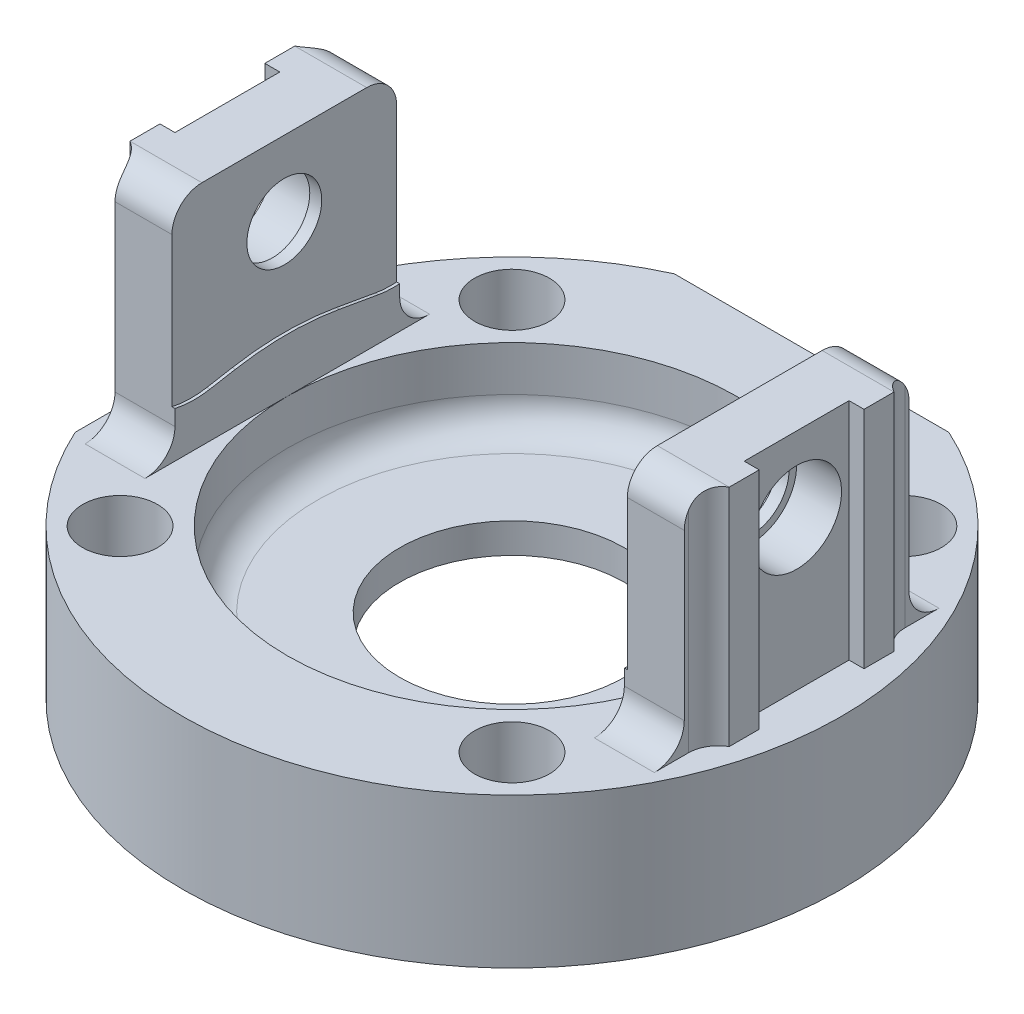
from build123d import *

# Parameters (mm, degrees)
SKETCH1_R                = 22
BOSS_EXTRUDE1_DEPTH      = 10
SKETCH5_R                = 15
CUT_EXTRUDE3_DEPTH       = 5
CUT_EXTRUDE5_START       = -3
SKETCH7_R                = 15
CUT_EXTRUDE5_DEPTH       = 3
SKETCH8_R                = 7.5
CUT_EXTRUDE6_DEPTH       = 3
SKETCH6_R                = 2.5
CUT_EXTRUDE7_DEPTH       = 10
SKETCH9_W                = 6.833639819
SKETCH9_H                = 40.698121589
SKETCH9_W_2              = 26.089318242
SKETCH9_H_2              = 6.104718238
CUT_EXTRUDE8_DEPTH       = 10
BOSS_EXTRUDE3_DEPTH      = 15
FILLET1_R                = 2
FILLET2_R                = 10
CUT_EXTRUDE9_DEPTH       = 42
CUT_EXTRUDE9_DEPTH_BACK  = 15
SKETCH11_R               = 3
FILLET3_START            = 9
FILLET3_DEPTH            = 16
FILLET3_START_2          = -21
FILLET3_2_DEPTH          = 42
FILLET4_R                = 2
CUT_EXTRUDE18_DEPTH      = 30.2
CUT_EXTRUDE18_DEPTH_BACK = 0.2
FILLET5_R                = 20
SKETCH14_R               = 3
SKETCH14_R_2             = 2.5
BOSS_EXTRUDE4_DEPTH      = 0.8
BOSS_EXTRUDE5_START      = -0.8
SKETCH15_R               = 3
SKETCH15_R_2             = 2.5
BOSS_EXTRUDE5_DEPTH      = 0.8
SKETCH17_R               = 2.5
CUT_EXTRUDE20_DEPTH      = 4
SKETCH18_R               = 2.5
CUT_EXTRUDE21_DEPTH      = 4


with BuildPart() as part:
    # Sketch1 → Boss-Extrude1 (new body)
    with BuildSketch(Plane(origin=(0, 0, 0), x_dir=(1, 0, 0), z_dir=(0, 1, 0))):
        with Locations(Location((0, 0, 0), (0, 0, 270))):
            Circle(SKETCH1_R)
    extrude(amount=BOSS_EXTRUDE1_DEPTH)

    # Sketch5 → Cut-Extrude3 (cut)
    with BuildSketch(Plane(origin=(0, 10, 0), x_dir=(1, 0, 0), z_dir=(0, 1, 0))):
        with Locations(Location((0, 0, 0), (0, 0, 270))):
            Circle(SKETCH5_R)
    extrude(amount=-CUT_EXTRUDE3_DEPTH, mode=Mode.SUBTRACT)

    # Sketch7 → Cut-Extrude5 (cut)
    with BuildSketch(Plane(origin=(0, 0, 0), x_dir=(-1, 0, 0), z_dir=(0, -1, 0)).offset(CUT_EXTRUDE5_START)):
        with Locations(Location((0, 0, 0), (0, 0, 270))):
            Circle(SKETCH7_R)
    extrude(amount=CUT_EXTRUDE5_DEPTH, mode=Mode.SUBTRACT)

    # Sketch8 → Cut-Extrude6 (cut)
    with BuildSketch(Plane(origin=(0, 3, 0), x_dir=(-1, 0, 0), z_dir=(0, -1, 0))):
        with Locations(Location((0, 0, 0), (0, 0, 90))):
            Circle(SKETCH8_R)
    extrude(amount=-CUT_EXTRUDE6_DEPTH, mode=Mode.SUBTRACT)

    # Sketch6 → Cut-Extrude7 (cut)
    with BuildSketch(Plane(origin=(0, 10, 0), x_dir=(1, 0, 0), z_dir=(0, 1, 0))):
        with Locations(Location((13.081475452, 13.081475452, 0), (0, 0, 270))):
            Circle(SKETCH6_R)
        with Locations(Location((-13.081475452, -13.081475452, 0), (0, 0, 270))):
            Circle(SKETCH6_R)
        with Locations(Location((-13.081475452, 13.081475452, 0), (0, 0, 270))):
            Circle(SKETCH6_R)
        with Locations(Location((13.081475452, -13.081475452, 0), (0, 0, 270))):
            Circle(SKETCH6_R)
    extrude(amount=-CUT_EXTRUDE7_DEPTH, mode=Mode.SUBTRACT)

    # Sketch9 → Cut-Extrude8 (cut)
    with BuildSketch(Plane(origin=(0, 10, 0), x_dir=(1, 0, 0), z_dir=(0, 1, 0))):
        with Locations((-23.416819909, -5.65916064)):
            Rectangle(SKETCH9_W, SKETCH9_H)
        with Locations((-0.506301064, 23.052359119)):
            Rectangle(SKETCH9_W_2, SKETCH9_H_2)
    extrude(amount=-CUT_EXTRUDE8_DEPTH, mode=Mode.SUBTRACT)

    # Sketch10 → Boss-Extrude3 (add)
    with BuildSketch(Plane(origin=(0, 10, 0), x_dir=(1, 0, 0), z_dir=(0, 1, 0))):
        Polygon((-15, -7.5), (-15, 7.5), (-19, 7.5), (-19, 5.5), (-20, 5.5), (-20, 3.5), (-19, 3.5), (-19, -3.5), (-20, -3.5), (-20, -5.5), (-19, -5.5), (-19, -7.5), align=None)
        Polygon((20, -5.5), (20, -3.5), (19, -3.5), (19, 3.5), (20, 3.5), (20, 5.5), (19, 5.5), (19, 7.5), (15, 7.5), (15, -7.5), (19, -7.5), (19, -5.5), align=None)
    extrude(amount=BOSS_EXTRUDE3_DEPTH)

    # Fillet1
    fillet1_edges = [part.edges().sort_by_distance(p)[0] for p in [
        (-17, 10, -7.5),
        (-17, 25, -7.5),
        (-17, 10, 7.5),
        (-17, 25, 7.5),
        (17, 10, -7.5),
        (17, 10, 7.5),
        (17, 25, -7.5),
        (17, 25, 7.5),
    ]]
    fillet(fillet1_edges, radius=FILLET1_R)

    # Fillet2
    # the kernel refuses this fillet: 10 mm, written as the material it adds along each edge
    with BuildSketch(Plane(origin=(-19, 10, -14.397247359), x_dir=(0, 1, 0), z_dir=(0, 0, 1))) as fillet2_piece_1_section:
        with BuildLine():
            CenterArc((4.358898944, 10), FILLET2_R, 244.158067237, 25.841932763)
            Line((0, 1), (0, 0))
            Line((0, 0), (4.358898944, 0))
        make_face()
    fillet2_piece_1 = extrude(amount=28.794494718, mode=Mode.PRIVATE)
    fillet2_piece_1 = split(fillet2_piece_1, bisect_by=Plane(origin=(-19, 10, -5.5), z_dir=(0, 0, 1)), keep=Keep.TOP, mode=Mode.PRIVATE)
    fillet2_piece_1 = split(fillet2_piece_1, bisect_by=Plane(origin=(-19, 10, 5.5), z_dir=(0, 0, -1)), keep=Keep.TOP, mode=Mode.PRIVATE)
    add(fillet2_piece_1)

    # Sketch11 → Cut-Extrude9 (cut, two sides: drawn at the far end of the back side and taken through both)
    with BuildSketch(Plane(origin=(-15, 0, 0), x_dir=(0, 0, -1), z_dir=(1, 0, 0)).offset(-CUT_EXTRUDE9_DEPTH_BACK)):
        with Locations(Location((0, 20, 0), (0, 0, 180))):
            Circle(SKETCH11_R)
    extrude(amount=CUT_EXTRUDE9_DEPTH + CUT_EXTRUDE9_DEPTH_BACK, mode=Mode.SUBTRACT)

    # Fillet3: read off the stored shape, not the designer's step
    # Fillet3 outline → Fillet3 (add)
    with BuildSketch(Plane(origin=(0, 0, 0), x_dir=(1, 0, 0), z_dir=(0, 1, 0)).offset(FILLET3_START)):
        with BuildLine():
            Line((19, -5.5), (19, -7.232050808))
            ThreePointArc((19, -7.232050808), (19.267949192, -6.232050808), (20, -5.5))
            Line((20, -5.5), (19, -5.5))
        make_face()
        with BuildLine():
            Line((19, 5.5), (20, 5.5))
            ThreePointArc((20, 5.5), (19.267949192, 6.232050808), (19, 7.232050808))
            Line((19, 7.232050808), (19, 5.5))
        make_face()
        with BuildLine():
            ThreePointArc((-19, 7.232050808), (-19.267949192, 6.232050808), (-20, 5.5))
            Line((-20, 5.5), (-19, 5.5))
            Line((-19, 5.5), (-19, 7.232050808))
        make_face()
        with BuildLine():
            ThreePointArc((-20, -5.5), (-19.267949192, -6.232050808), (-19, -7.232050808))
            Line((-19, -7.232050808), (-19, -5.5))
            Line((-19, -5.5), (-20, -5.5))
        make_face()
    extrude(amount=FILLET3_DEPTH)

    # Fillet3 2 outline → Fillet3 2 (cut)
    with BuildSketch(Plane.YZ.offset(FILLET3_START_2)):
        with BuildLine():
            ThreePointArc((25, -5.5), (24.732050807, -6.5), (23.999999999, -7.232050808))
            Line((23.999999999, -7.232050808), (25, -7.232050808))
            Line((25, -7.232050808), (25, -5.5))
        make_face()
        with BuildLine():
            ThreePointArc((23.999999999, 7.232050808), (24.732050807, 6.5), (25, 5.5))
            Line((25, 5.5), (25, 7.232050808))
            Line((25, 7.232050808), (23.999999999, 7.232050808))
        make_face()
    extrude(amount=FILLET3_2_DEPTH, mode=Mode.SUBTRACT)

    # Fillet4
    fillet4_edges = [part.edges().sort_by_distance(p)[0] for p in [
        (0, 3, -15),
        (0, 5, -15),
    ]]
    fillet(fillet4_edges, radius=FILLET4_R)

    # Sketch13 → Cut-Extrude18 (cut, two sides: drawn at the far end of the back side and taken through both)
    with BuildSketch(Plane.ZY.offset(-15).offset(-CUT_EXTRUDE18_DEPTH_BACK)):
        with BuildLine():
            ThreePointArc((-1.041889066, 14.091153482), (-4.242640687, 15.757359313), (-5.908846518, 18.958110934))
            ThreePointArc((-5.908846518, 18.958110934), (-5.513931092, 22.365705796), (-3.31662479, 25))
            Line((-3.31662479, 25), (-5.5, 25))
            ThreePointArc((-5.5, 25), (-6.914213562, 24.414213562), (-7.5, 23))
            Line((-7.5, 23), (-7.5, 12.759289849))
            ThreePointArc((-7.5, 12.759289849), (-6.78111068, 12.755479981), (-6.066925886, 12.837677605))
            Line((-6.066925886, 12.837677605), (0, 13.907440329))
            Line((0, 13.907440329), (-1.041889066, 14.091153482))
        make_face()
        with BuildLine():
            ThreePointArc((2.954423259, 19.479055467), (0, 17), (-2.954423259, 19.479055467))
            Line((-2.954423259, 19.479055467), (-5.908846518, 18.958110934))
            ThreePointArc((-5.908846518, 18.958110934), (-4.242640687, 15.757359313), (-1.041889066, 14.091153482))
            Line((-1.041889066, 14.091153482), (0, 13.907440329))
            Line((0, 13.907440329), (1.041889066, 14.091153482))
            ThreePointArc((1.041889066, 14.091153482), (4.242640687, 15.757359313), (5.908846518, 18.958110934))
            Line((5.908846518, 18.958110934), (2.954423259, 19.479055467))
        make_face()
        with BuildLine():
            Line((-5.908846518, 18.958110934), (-2.954423259, 19.479055467))
            ThreePointArc((-2.954423259, 19.479055467), (-0.261467228, 22.988584094), (3, 20))
            ThreePointArc((3, 20), (2.988584094, 19.738532772), (2.954423259, 19.479055467))
            Line((2.954423259, 19.479055467), (5.908846518, 18.958110934))
            ThreePointArc((5.908846518, 18.958110934), (5.513931092, 22.365705796), (3.31662479, 25))
            Line((3.31662479, 25), (-3.31662479, 25))
            ThreePointArc((-3.31662479, 25), (-5.513931092, 22.365705796), (-5.908846518, 18.958110934))
        make_face()
        with BuildLine():
            Line((-2.954423259, 19.479055467), (0, 20))
            Line((0, 20), (2.954423259, 19.479055467))
            ThreePointArc((2.954423259, 19.479055467), (2.988584094, 19.738532772), (3, 20))
            ThreePointArc((3, 20), (-0.261467228, 22.988584094), (-2.954423259, 19.479055467))
        make_face()
        with BuildLine():
            Line((2.954423259, 19.479055467), (0, 20))
            Line((0, 20), (-2.954423259, 19.479055467))
            ThreePointArc((-2.954423259, 19.479055467), (0, 17), (2.954423259, 19.479055467))
        make_face()
        with BuildLine():
            ThreePointArc((3.31662479, 25), (5.513931092, 22.365705796), (5.908846518, 18.958110934))
            ThreePointArc((5.908846518, 18.958110934), (4.242640687, 15.757359313), (1.041889066, 14.091153482))
            Line((1.041889066, 14.091153482), (0, 13.907440329))
            Line((0, 13.907440329), (5.162816476, 12.997096488))
            ThreePointArc((5.162816476, 12.997096488), (6.333883164, 12.907333738), (7.5, 13.047426789))
            Line((7.5, 13.047426789), (7.5, 23))
            ThreePointArc((7.5, 23), (6.914213562, 24.414213562), (5.5, 25))
            Line((5.5, 25), (3.31662479, 25))
        make_face()
    extrude(amount=CUT_EXTRUDE18_DEPTH + CUT_EXTRUDE18_DEPTH_BACK, mode=Mode.SUBTRACT)

    # Fillet5
    fillet5_edges = [part.edges().sort_by_distance(p)[0] for p in [
        (15.1, 13.907440329, 0),
        (-15.1, 13.907440329, 0),
    ]]
    fillet(fillet5_edges, radius=FILLET5_R)

    # Sketch14 → Boss-Extrude4 (add)
    with BuildSketch(Plane.ZY.offset(-15.2)):
        with Locations((0, 20)):
            Circle(SKETCH14_R)
        with Locations((0, 20)):
            Circle(SKETCH14_R_2, mode=Mode.SUBTRACT)
    extrude(amount=-BOSS_EXTRUDE4_DEPTH)

    # Sketch15 → Boss-Extrude5 (add)
    with BuildSketch(Plane(origin=(-15.2, 0, 0), x_dir=(0, 0, -1), z_dir=(1, 0, 0)).offset(BOSS_EXTRUDE5_START)):
        with Locations(Location((0, 20, 0), (0, 0, 180))):
            Circle(SKETCH15_R)
        with Locations(Location((0, 20, 0), (0, 0, 180))):
            Circle(SKETCH15_R_2, mode=Mode.SUBTRACT)
    extrude(amount=BOSS_EXTRUDE5_DEPTH)

    # Sketch17 → Cut-Extrude20 (cut)
    with BuildSketch(Plane(origin=(0, 0, -20), x_dir=(-1, 0, 0), z_dir=(0, 0, -1))):
        with Locations((-5, 5)):
            Circle(SKETCH17_R)
        with Locations((5, 5)):
            Circle(SKETCH17_R)
    extrude(amount=-CUT_EXTRUDE20_DEPTH, mode=Mode.SUBTRACT)

    # Sketch18 → Cut-Extrude21 (cut)
    with BuildSketch(Plane.ZY.offset(20)):
        with Locations((-5, 5)):
            Circle(SKETCH18_R)
        with Locations((5, 5)):
            Circle(SKETCH18_R)
    extrude(amount=-CUT_EXTRUDE21_DEPTH, mode=Mode.SUBTRACT)


solid = part.part
